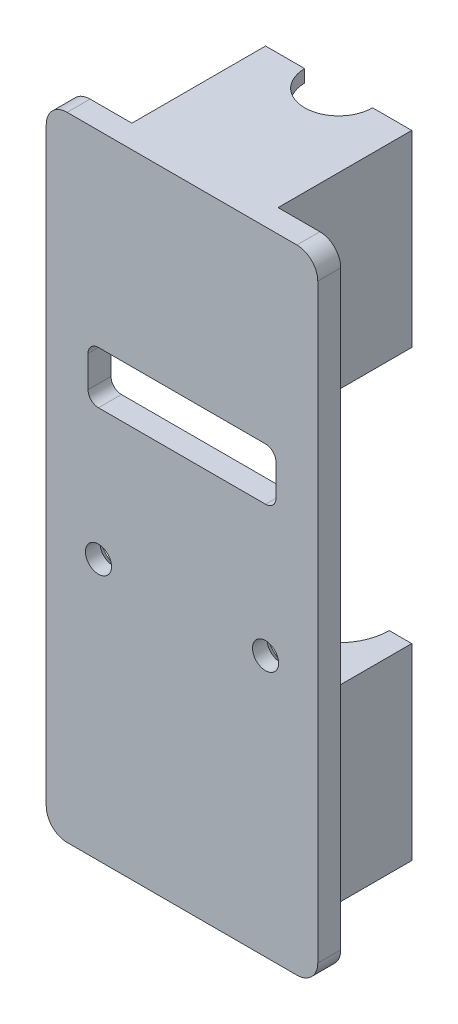
from build123d import *

# Parameters (mm, degrees)
SKETCH1_W                     = 32.5
SKETCH1_H                     = 75.691874882
SKETCH1_R                     = 2.6
BOSS_EXTRUDE1_DEPTH           = 2
BOSS_EXTRUDE2_START           = 2
SKETCH1_2_W                   = 32.5
SKETCH1_2_H                   = 75.691874882
BOSS_EXTRUDE2_DEPTH           = 0.75
SKETCH6_R                     = 1.5625
CUT_EXTRUDE5_DEPTH            = 42.27880789
SKETCH2_W                     = 17.5
SKETCH2_H                     = 22.5
BOSS_EXTRUDE3_DEPTH           = 16
CUT_EXTRUDE6_DEPTH            = 58.874329832
SKETCH7_3_R                   = 6.0625
SKETCH7_3_R_2                 = 4.0625
CUT_EXTRUDE7_DEPTH            = 3.5
LPATTERN3_COUNT               = 3
LPATTERN3_PITCH               = 8.75
CIRPATTERN3_COUNT             = 2
CIRPATTERN3_COPY_1_SKETCH_R   = 6.0625
CIRPATTERN3_COPY_1_SKETCH_R_2 = 4.0625
CIRPATTERN3_COPY_1_DEPTH      = 3.5
CIRPATTERN3_COPY_2_SKETCH_R   = 6.0625
CIRPATTERN3_COPY_2_SKETCH_R_2 = 4.0625
CIRPATTERN3_COPY_2_DEPTH      = 3.5
SKETCH8_W                     = 22.5
SKETCH8_H                     = 6.25
CUT_EXTRUDE8_DEPTH            = 45.1857158
BOSS_EXTRUDE4_START           = -18.845937441
BOSS_EXTRUDE4_DEPTH           = 0.25
BOSS_EXTRUDE6_START           = 18.595937441
BOSS_EXTRUDE6_DEPTH           = 0.25
FILLET1_R                     = 2.5
FILLET2_R                     = 1.25
CHAMFER1_SIZE                 = 1


# Read off the part's stored shape, not the designer's step: Boss-Extrude4, Boss-Extrude6
with BuildPart() as part:
    # Sketch1 → Boss-Extrude1 (new body)
    with BuildSketch(Plane.XY):
        Rectangle(SKETCH1_W, SKETCH1_H)
        with Locations((12.5, 34.095937441)):
            Circle(SKETCH1_R, mode=Mode.SUBTRACT)
        with Locations((-12.5, 34.095937441)):
            Circle(SKETCH1_R, mode=Mode.SUBTRACT)
        with Locations((12.5, 26.595937441)):
            Circle(SKETCH1_R, mode=Mode.SUBTRACT)
        with Locations((12.5, 19.095937441)):
            Circle(SKETCH1_R, mode=Mode.SUBTRACT)
        with Locations((-12.5, 26.595937441)):
            Circle(SKETCH1_R, mode=Mode.SUBTRACT)
        with Locations((-12.5, 19.095937441)):
            Circle(SKETCH1_R, mode=Mode.SUBTRACT)
        with Locations(Location((-12.5, -19.095937441, 0), (0, 0, 180))):
            Circle(SKETCH1_R, mode=Mode.SUBTRACT)
        with Locations(Location((-12.5, -26.595937441, 0), (0, 0, 180))):
            Circle(SKETCH1_R, mode=Mode.SUBTRACT)
        with Locations(Location((12.5, -19.095937441, 0), (0, 0, 180))):
            Circle(SKETCH1_R, mode=Mode.SUBTRACT)
        with Locations(Location((12.5, -26.595937441, 0), (0, 0, 180))):
            Circle(SKETCH1_R, mode=Mode.SUBTRACT)
        with Locations(Location((-12.5, -34.095937441, 0), (0, 0, 180))):
            Circle(SKETCH1_R, mode=Mode.SUBTRACT)
        with Locations(Location((12.5, -34.095937441, 0), (0, 0, 180))):
            Circle(SKETCH1_R, mode=Mode.SUBTRACT)
    extrude(amount=BOSS_EXTRUDE1_DEPTH)

    # Sketch1<2> → Boss-Extrude2 (add)
    with BuildSketch(Plane.XY.offset(BOSS_EXTRUDE2_START)):
        Rectangle(SKETCH1_2_W, SKETCH1_2_H)
    extrude(amount=BOSS_EXTRUDE2_DEPTH)

    # Sketch6 → Cut-Extrude5 (cut, through all)
    with BuildSketch(Plane.XY.offset(2.75)):
        with Locations((10, -6.595937441)):
            Circle(SKETCH6_R)
        with Locations((-10, -6.595937441)):
            Circle(SKETCH6_R)
    extrude(amount=-CUT_EXTRUDE5_DEPTH, mode=Mode.SUBTRACT)

    # Sketch2 → Boss-Extrude3 (add)
    with BuildSketch(Plane(origin=(0, 0, 0), x_dir=(-1, 0, 0), z_dir=(0, 0, -1))):
        with Locations((0, -26.595937441)):
            Rectangle(SKETCH2_W, SKETCH2_H)
    boss_extrude3 = extrude(amount=BOSS_EXTRUDE3_DEPTH)

    # Sketch7 → Cut-Extrude6 (cut, through all)
    with BuildSketch(Plane(origin=(0, -15.345937441, 0), x_dir=(1, 0, 0), z_dir=(0, 1, 0))):
        with BuildLine():
            Line((-4.0625, 16), (4.0625, 16))
            ThreePointArc((4.0625, 16), (0, 20.0625), (-4.0625, 16))
        make_face()
        with BuildLine():
            ThreePointArc((-4.0625, 16), (0, 11.9375), (4.0625, 16))
            Line((4.0625, 16), (-4.0625, 16))
        make_face()
    cut_extrude6 = extrude(amount=-CUT_EXTRUDE6_DEPTH, mode=Mode.SUBTRACT)

    # Sketch7<3> → Cut-Extrude7 (cut)
    with BuildSketch(Plane(origin=(0, -15.345937441, 0), x_dir=(1, 0, 0), z_dir=(0, 1, 0))):
        with Locations((0, 16)):
            Circle(SKETCH7_3_R)
        with Locations((0, 16)):
            Circle(SKETCH7_3_R_2, mode=Mode.SUBTRACT)
    cut_extrude7 = extrude(amount=-CUT_EXTRUDE7_DEPTH, mode=Mode.SUBTRACT)

    # LPattern3: Cut-Extrude7 ×3
    with Locations(*[(0, -i * LPATTERN3_PITCH, 0) for i in range(1, LPATTERN3_COUNT)]):
        add(cut_extrude7, mode=Mode.SUBTRACT)

    # CirPattern3: Boss-Extrude3, Cut-Extrude6, Cut-Extrude7 ×2 about axis
    cirpattern3_axis = Axis((0, 0, 0), (0, 0, 1))
    add([boss_extrude3.rotate(cirpattern3_axis, i * 360 / CIRPATTERN3_COUNT) for i in range(1, CIRPATTERN3_COUNT)])
    add([cut_extrude6.rotate(cirpattern3_axis, i * 360 / CIRPATTERN3_COUNT) for i in range(1, CIRPATTERN3_COUNT)], mode=Mode.SUBTRACT)
    add([cut_extrude7.rotate(cirpattern3_axis, i * 360 / CIRPATTERN3_COUNT) for i in range(1, CIRPATTERN3_COUNT)], mode=Mode.SUBTRACT)

    # CirPattern3 copy 1 sketch → CirPattern3 copy 1 (cut)
    with BuildSketch(Plane(origin=(0, 24.095937441, 0), x_dir=(-1, 0, 0), z_dir=(0, -1, 0))):
        with Locations((0, 16)):
            Circle(CIRPATTERN3_COPY_1_SKETCH_R)
        with Locations((0, 16)):
            Circle(CIRPATTERN3_COPY_1_SKETCH_R_2, mode=Mode.SUBTRACT)
    extrude(amount=-CIRPATTERN3_COPY_1_DEPTH, mode=Mode.SUBTRACT)

    # CirPattern3 copy 2 sketch → CirPattern3 copy 2 (cut)
    with BuildSketch(Plane(origin=(0, 32.845937441, 0), x_dir=(-1, 0, 0), z_dir=(0, -1, 0))):
        with Locations((0, 16)):
            Circle(CIRPATTERN3_COPY_2_SKETCH_R)
        with Locations((0, 16)):
            Circle(CIRPATTERN3_COPY_2_SKETCH_R_2, mode=Mode.SUBTRACT)
    extrude(amount=-CIRPATTERN3_COPY_2_DEPTH, mode=Mode.SUBTRACT)

    # Sketch8 → Cut-Extrude8 (cut, through all)
    with BuildSketch(Plane(origin=(0, 0, 0), x_dir=(-1, 0, 0), z_dir=(0, 0, -1))):
        with Locations((0, 12.220937441)):
            Rectangle(SKETCH8_W, SKETCH8_H)
    extrude(amount=-CUT_EXTRUDE8_DEPTH, mode=Mode.SUBTRACT)

    # Boss-Extrude4 outline → Boss-Extrude4 (add)
    with BuildSketch(Plane(origin=(0, 0, 0), x_dir=(1, 0, 0), z_dir=(0, 1, 0)).offset(BOSS_EXTRUDE4_START)):
        with BuildLine():
            ThreePointArc((4.0625, 16), (0, 11.9375), (-4.0625, 16))
            Line((-4.0625, 16), (-6.0625, 16))
            ThreePointArc((-6.0625, 16), (0, 9.9375), (6.0625, 16))
            Line((6.0625, 16), (4.0625, 16))
        make_face()
    extrude(amount=BOSS_EXTRUDE4_DEPTH)

    # Boss-Extrude6 outline → Boss-Extrude6 (add)
    with BuildSketch(Plane(origin=(0, 0, 0), x_dir=(1, 0, 0), z_dir=(0, 1, 0)).offset(BOSS_EXTRUDE6_START)):
        with BuildLine():
            Line((6.0625, 16), (4.0625, 16))
            ThreePointArc((4.0625, 16), (0, 11.9375), (-4.0625, 16))
            Line((-4.0625, 16), (-6.0625, 16))
            ThreePointArc((-6.0625, 16), (0, 9.9375), (6.0625, 16))
        make_face()
    extrude(amount=BOSS_EXTRUDE6_DEPTH)

    # Fillet1
    fillet1_edges = [part.edges().sort_by_distance(p)[0] for p in [
        (-16.25, 37.845937441, 1.375),
        (16.25, 37.845937441, 1.375),
        (16.25, -37.845937441, 1.375),
        (-16.25, -37.845937441, 1.375),
    ]]
    fillet(fillet1_edges, radius=FILLET1_R)

    # Fillet2
    fillet2_edges = [part.edges().sort_by_distance(p)[0] for p in [
        (11.25, 9.095937441, 1.375),
        (11.25, 15.345937441, 1.375),
        (-11.25, 15.345937441, 1.375),
        (-11.25, 9.095937441, 1.375),
    ]]
    fillet(fillet2_edges, radius=FILLET2_R)

    # Chamfer1
    chamfer1_edges = [part.edges().sort_by_distance(p)[0] for p in [
        (8.4375, -6.595937441, 0),
        (-11.5625, -6.595937441, 0),
    ]]
    chamfer(chamfer1_edges, length=CHAMFER1_SIZE)


solid = part.part
